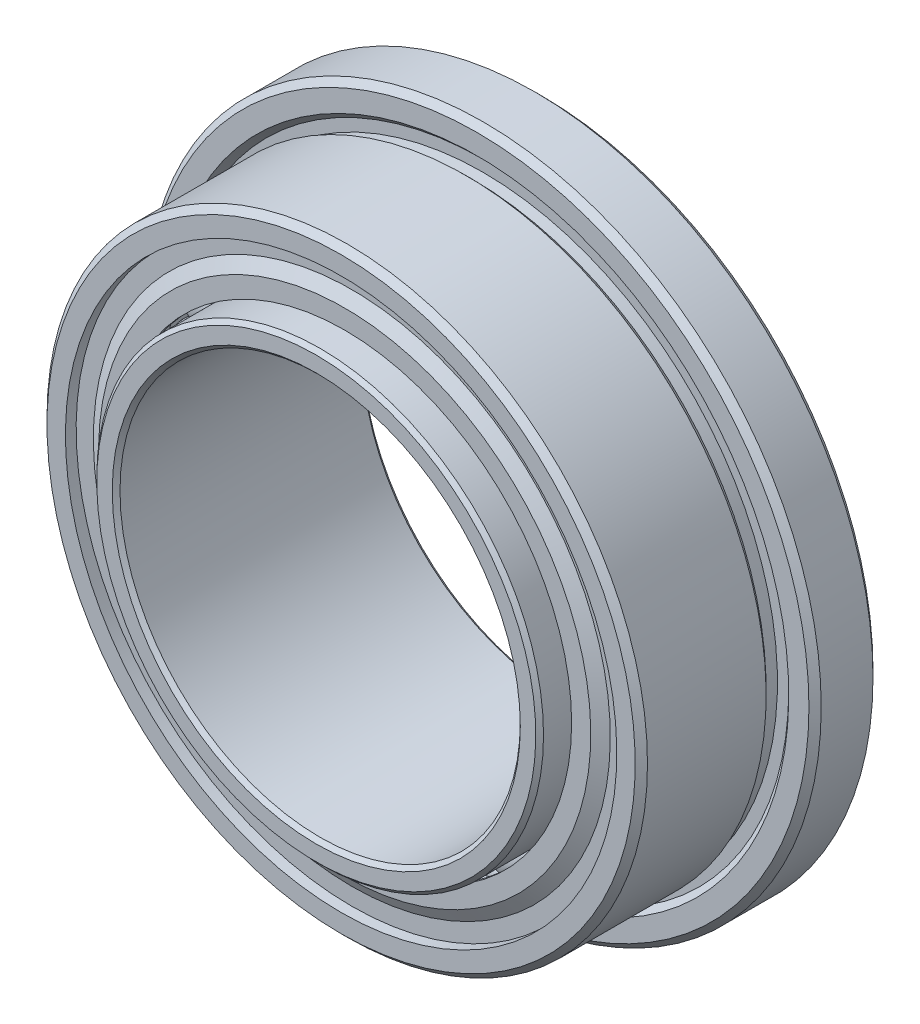
from build123d import *

# Parameters (mm, degrees)
FILLET1_SIZE      = 0.097366667
FILLET2_SIZE      = 0.061383333
CIRPATTERN3_COUNT = 27
SKETCH8_W         = 0.226785714
SKETCH8_H         = 0.194733333


with BuildPart() as part:
    # Sketch2 → Revolve1 (revolve)
    with BuildSketch(Plane(origin=(0, 0, 0), x_dir=(0, 0, -1), z_dir=(1, 0, 0)), mode=Mode.PRIVATE) as revolve1_sk:
        with BuildLine():
            Line((1.5875, 5.3594), (0.5715, 5.3594))
            Line((0.5715, 5.3594), (0.5715, 4.942105122))
            Line((0.5715, 4.942105122), (0.661302561, 4.852302561))
            Line((0.661302561, 4.852302561), (0.661302561, 4.672697439))
            Line((0.661302561, 4.672697439), (0.481697439, 4.672697439))
            Line((0.481697439, 4.672697439), (0.391894878, 4.7625))
            Line((0.391894878, 4.7625), (-1.5875, 4.7625))
            Line((-1.5875, 4.7625), (-1.5875, 4.1783))
            Line((-1.5875, 4.1783), (-0.238125, 4.1783))
            ThreePointArc((-0.238125, 4.1783), (0, 4.257675), (0.238125, 4.1783))
            Line((0.238125, 4.1783), (1.5875, 4.1783))
            Line((1.5875, 4.1783), (1.5875, 5.3594))
        make_face()
        with BuildLine():
            Line((1.9812, 3.175), (-1.9812, 3.175))
            Line((-1.9812, 3.175), (-1.9812, 3.5433))
            Line((-1.9812, 3.5433), (-0.238125, 3.5433))
            ThreePointArc((-0.238125, 3.5433), (0, 3.463925), (0.238125, 3.5433))
            Line((0.238125, 3.5433), (1.9812, 3.5433))
            Line((1.9812, 3.5433), (1.9812, 3.175))
        make_face()
    revolve(revolve1_sk.sketch.rotate(Axis((0, 0, 0), (0, 0, -1)), 180), axis=Axis((0, 0, 0), (0, 0, -1)))

    # Fillet1
    fillet1_edges = [part.edges().sort_by_distance(p)[0] for p in [
        (0, 4.7625, 1.5875),
        (0, 5.3594, -1.5875),
        (0, 5.3594, -0.5715),
    ]]
    chamfer(fillet1_edges, length=FILLET1_SIZE)

    # Fillet2
    fillet2_edges = [part.edges().sort_by_distance(p)[0] for p in [
        (0, 3.5433, -1.9812),
        (0, 3.175, -1.9812),
        (0, 3.175, 1.9812),
        (0, 3.5433, 1.9812),
    ]]
    chamfer(fillet2_edges, length=FILLET2_SIZE)

    # Sketch8 → Cut-Revolve1 (revolve, cut)
    with BuildSketch(Plane(origin=(0, 0, 0), x_dir=(0, 0, -1), z_dir=(1, 0, 0)), mode=Mode.PRIVATE) as cut_revolve1_sk:
        with Locations((-1.474107143, 4.275666667)):
            Rectangle(SKETCH8_W, SKETCH8_H)
        with Locations((1.474107143, 4.275666667)):
            Rectangle(SKETCH8_W, SKETCH8_H)
    revolve(cut_revolve1_sk.sketch.rotate(Axis((0, 0, 0), (0, 0, -1)), 180), axis=Axis((0, 0, 0), (0, 0, -1)), mode=Mode.SUBTRACT)


with BuildPart() as body_2:
    # Sketch7 → Revolve3 (revolve)
    with BuildSketch(Plane.XY):
        with BuildLine():
            Line((0, 4.257675), (0, 3.463925))
            ThreePointArc((0, 3.463925), (-0.396875, 3.8608), (0, 4.257675))
        make_face()
    revolve(axis=Axis((0, 4.257675, 0), (0, -1, 0)))


with BuildPart() as cirpattern3_1:
    # CirPattern3: pattern copy
    add(body_2.part.rotate(Axis((0, 0, 0), (0, 0, 1)), 1 * 360 / CIRPATTERN3_COUNT))


with BuildPart() as cirpattern3_2:
    # CirPattern3: pattern copy
    add(body_2.part.rotate(Axis((0, 0, 0), (0, 0, 1)), 2 * 360 / CIRPATTERN3_COUNT))


with BuildPart() as cirpattern3_3:
    # CirPattern3: pattern copy
    add(body_2.part.rotate(Axis((0, 0, 0), (0, 0, 1)), 3 * 360 / CIRPATTERN3_COUNT))


with BuildPart() as cirpattern3_4:
    # CirPattern3: pattern copy
    add(body_2.part.rotate(Axis((0, 0, 0), (0, 0, 1)), 4 * 360 / CIRPATTERN3_COUNT))


with BuildPart() as cirpattern3_5:
    # CirPattern3: pattern copy
    add(body_2.part.rotate(Axis((0, 0, 0), (0, 0, 1)), 5 * 360 / CIRPATTERN3_COUNT))


with BuildPart() as cirpattern3_6:
    # CirPattern3: pattern copy
    add(body_2.part.rotate(Axis((0, 0, 0), (0, 0, 1)), 6 * 360 / CIRPATTERN3_COUNT))


with BuildPart() as cirpattern3_7:
    # CirPattern3: pattern copy
    add(body_2.part.rotate(Axis((0, 0, 0), (0, 0, 1)), 7 * 360 / CIRPATTERN3_COUNT))


with BuildPart() as cirpattern3_8:
    # CirPattern3: pattern copy
    add(body_2.part.rotate(Axis((0, 0, 0), (0, 0, 1)), 8 * 360 / CIRPATTERN3_COUNT))


with BuildPart() as cirpattern3_9:
    # CirPattern3: pattern copy
    add(body_2.part.rotate(Axis((0, 0, 0), (0, 0, 1)), 9 * 360 / CIRPATTERN3_COUNT))


with BuildPart() as cirpattern3_10:
    # CirPattern3: pattern copy
    add(body_2.part.rotate(Axis((0, 0, 0), (0, 0, 1)), 10 * 360 / CIRPATTERN3_COUNT))


with BuildPart() as cirpattern3_11:
    # CirPattern3: pattern copy
    add(body_2.part.rotate(Axis((0, 0, 0), (0, 0, 1)), 11 * 360 / CIRPATTERN3_COUNT))


with BuildPart() as cirpattern3_12:
    # CirPattern3: pattern copy
    add(body_2.part.rotate(Axis((0, 0, 0), (0, 0, 1)), 12 * 360 / CIRPATTERN3_COUNT))


with BuildPart() as cirpattern3_13:
    # CirPattern3: pattern copy
    add(body_2.part.rotate(Axis((0, 0, 0), (0, 0, 1)), 13 * 360 / CIRPATTERN3_COUNT))


with BuildPart() as cirpattern3_14:
    # CirPattern3: pattern copy
    add(body_2.part.rotate(Axis((0, 0, 0), (0, 0, 1)), 14 * 360 / CIRPATTERN3_COUNT))


with BuildPart() as cirpattern3_15:
    # CirPattern3: pattern copy
    add(body_2.part.rotate(Axis((0, 0, 0), (0, 0, 1)), 15 * 360 / CIRPATTERN3_COUNT))


with BuildPart() as cirpattern3_16:
    # CirPattern3: pattern copy
    add(body_2.part.rotate(Axis((0, 0, 0), (0, 0, 1)), 16 * 360 / CIRPATTERN3_COUNT))


with BuildPart() as cirpattern3_17:
    # CirPattern3: pattern copy
    add(body_2.part.rotate(Axis((0, 0, 0), (0, 0, 1)), 17 * 360 / CIRPATTERN3_COUNT))


with BuildPart() as cirpattern3_18:
    # CirPattern3: pattern copy
    add(body_2.part.rotate(Axis((0, 0, 0), (0, 0, 1)), 18 * 360 / CIRPATTERN3_COUNT))


with BuildPart() as cirpattern3_19:
    # CirPattern3: pattern copy
    add(body_2.part.rotate(Axis((0, 0, 0), (0, 0, 1)), 19 * 360 / CIRPATTERN3_COUNT))


with BuildPart() as cirpattern3_20:
    # CirPattern3: pattern copy
    add(body_2.part.rotate(Axis((0, 0, 0), (0, 0, 1)), 20 * 360 / CIRPATTERN3_COUNT))


with BuildPart() as cirpattern3_21:
    # CirPattern3: pattern copy
    add(body_2.part.rotate(Axis((0, 0, 0), (0, 0, 1)), 21 * 360 / CIRPATTERN3_COUNT))


with BuildPart() as cirpattern3_22:
    # CirPattern3: pattern copy
    add(body_2.part.rotate(Axis((0, 0, 0), (0, 0, 1)), 22 * 360 / CIRPATTERN3_COUNT))


with BuildPart() as cirpattern3_23:
    # CirPattern3: pattern copy
    add(body_2.part.rotate(Axis((0, 0, 0), (0, 0, 1)), 23 * 360 / CIRPATTERN3_COUNT))


with BuildPart() as cirpattern3_24:
    # CirPattern3: pattern copy
    add(body_2.part.rotate(Axis((0, 0, 0), (0, 0, 1)), 24 * 360 / CIRPATTERN3_COUNT))


with BuildPart() as cirpattern3_25:
    # CirPattern3: pattern copy
    add(body_2.part.rotate(Axis((0, 0, 0), (0, 0, 1)), 25 * 360 / CIRPATTERN3_COUNT))


with BuildPart() as cirpattern3_26:
    # CirPattern3: pattern copy
    add(body_2.part.rotate(Axis((0, 0, 0), (0, 0, 1)), 26 * 360 / CIRPATTERN3_COUNT))


with BuildPart() as body_29:
    # Sketch9 → Revolve4 (revolve)
    with BuildSketch(Plane(origin=(0, 0, 0), x_dir=(0, 0, -1), z_dir=(1, 0, 0)), mode=Mode.PRIVATE) as revolve4_sk:
        Polygon((-1.360714286, 4.373033333), (-1.360714286, 4.084715976), (-1.474107143, 3.888313786), (-1.474107143, 3.599996429), (-1.530803571, 3.599996429), (-1.530803571, 3.903505548), (-1.417410714, 4.099907738), (-1.417410714, 4.373033333), align=None)
        Polygon((1.360714286, 4.373033333), (1.360714286, 4.084715976), (1.474107143, 3.888313786), (1.474107143, 3.599996429), (1.530803571, 3.599996429), (1.530803571, 3.903505548), (1.417410714, 4.099907738), (1.417410714, 4.373033333), align=None)
    revolve(revolve4_sk.sketch.rotate(Axis((0, 0, 0), (0, 0, -1)), 180), axis=Axis((0, 0, 0), (0, 0, -1)))


solid = Compound([part.part, body_2.part, cirpattern3_1.part, cirpattern3_2.part, cirpattern3_3.part, cirpattern3_4.part, cirpattern3_5.part, cirpattern3_6.part, cirpattern3_7.part, cirpattern3_8.part, cirpattern3_9.part, cirpattern3_10.part, cirpattern3_11.part, cirpattern3_12.part, cirpattern3_13.part, cirpattern3_14.part, cirpattern3_15.part, cirpattern3_16.part, cirpattern3_17.part, cirpattern3_18.part, cirpattern3_19.part, cirpattern3_20.part, cirpattern3_21.part, cirpattern3_22.part, cirpattern3_23.part, cirpattern3_24.part, cirpattern3_25.part, cirpattern3_26.part, body_29.part])
